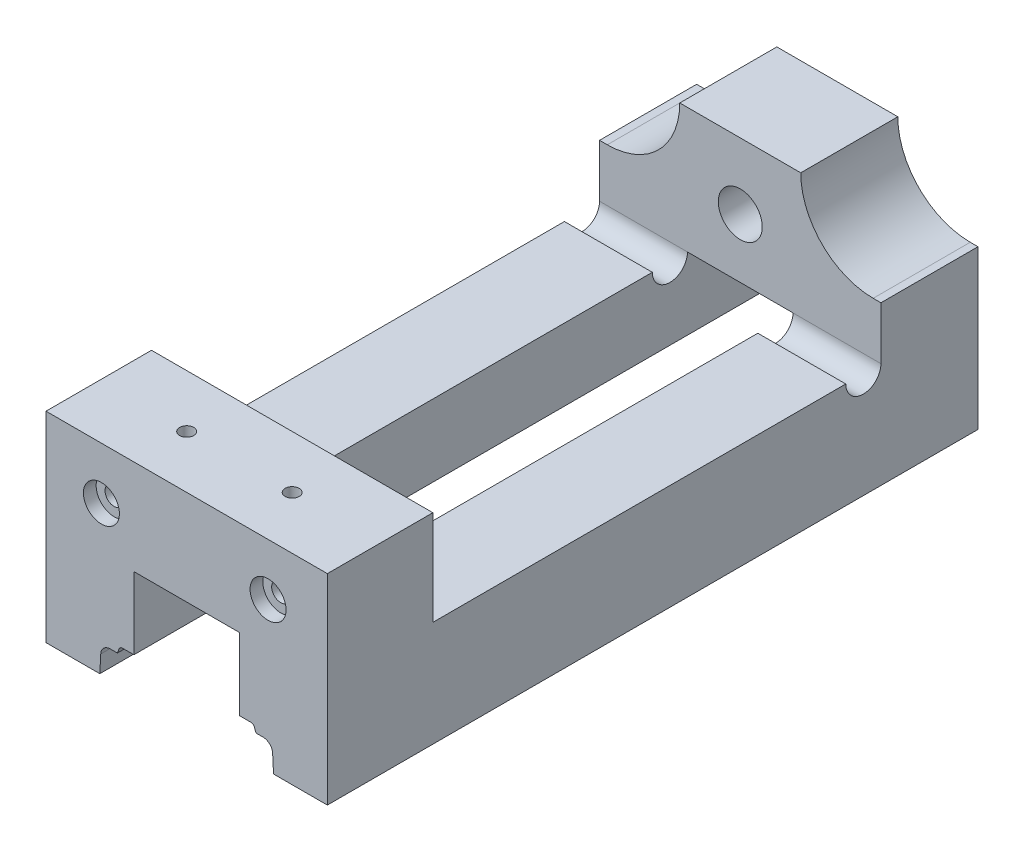
from build123d import *

# Parameters (mm, degrees)
SKETCH1_W                                    = 101.6
SKETCH1_H                                    = 83.312
SOLID_EXTRUDE_DEPTH                          = 234.95
BOTTOM_SLIDE_WAY_CUT_EXTRUDE_DEPTH           = 270.193149697
THROAT_CASTING_CUT_EXTRUDE_DEPTH             = 270.193149697
SHOULDERS_SCREW_HOLE_CUT_EXTRUDE_REACH       = 271.193
SKETCH4_R                                    = 7.9375
CBORE_START                                  = -38.1
CBORE_FOR_M6_PAN_HEAD_MACHINE_SCREW1_OUT_R   = 3.3
CBORE_FOR_M6_PAN_HEAD_MACHINE_SCREW1_DEPTH   = 38.1
CBORE_START_2                                = -4.6
CBORE_FOR_M6_PAN_HEAD_MACHINE_SCREW1_2_O_R   = 6.5
CBORE_FOR_M6_PAN_HEAD_MACHINE_SCREW1_2_O_R_2 = 3.3
CBORE_FOR_M6_PAN_HEAD_MACHINE_SCREW1_2_DEPTH = 4.6
SKETCH7_W                                    = 38.1
SKETCH7_H                                    = 10.922
STATIONARY_JAW_TRIM_CUT_EXTRUDE1_DEPTH       = 270.193149697
F_1_4_20_TAPPED_HOLE1_D                      = 5.1054
F_1_4_20_TAPPED_HOLE1_DEPTH                  = 14.986
F_1_4_20_TAPPED_HOLE1_TIP                    = 1.533816902
F_10_32_TAPPED_HOLE1_D                       = 4.0386
F_10_32_TAPPED_HOLE1_DEPTH                   = 11.938
F_10_32_TAPPED_HOLE1_TIP                     = 1.213317848


# Read off the part's stored shape, not the designer's step: CBORE for M6 Pan Head Machine Screw1
with BuildPart() as part:
    # Sketch1 → Solid extrude (new body)
    with BuildSketch(Plane.XY):
        with Locations((50.8, 41.656)):
            Rectangle(SKETCH1_W, SKETCH1_H)
    extrude(amount=-SOLID_EXTRUDE_DEPTH)

    # Sketch2 → Bottom slide way cut extrude (cut, through all)
    with BuildSketch(Plane.XY):
        with BuildLine():
            Line((19.431, 0), (19.763794004, 6.35008787))
            ThreePointArc((19.763794004, 6.35008787), (20.84487401, 8.695131686), (23.243283382, 9.652))
            Line((23.243283382, 9.652), (25.781, 9.652))
            Line((25.781, 9.652), (26.326795038, 11.151559542))
            ThreePointArc((26.326795038, 11.151559542), (26.849188972, 11.832356572), (27.667598166, 12.0904))
            Line((27.667598166, 12.0904), (31.75, 12.0904))
            Line((31.75, 12.0904), (31.75, 38.1))
            Line((31.75, 38.1), (69.85, 38.1))
            Line((69.85, 38.1), (69.85, 12.0904))
            Line((69.85, 12.0904), (73.932401834, 12.0904))
            ThreePointArc((73.932401834, 12.0904), (74.750811028, 11.832356572), (75.273204962, 11.151559542))
            Line((75.273204962, 11.151559542), (75.819, 9.652))
            Line((75.819, 9.652), (78.356716618, 9.652))
            ThreePointArc((78.356716618, 9.652), (80.75512599, 8.695131686), (81.836205996, 6.35008787))
            Line((81.836205996, 6.35008787), (82.169, 0))
            Line((82.169, 0), (19.431, 0))
        make_face()
    extrude(amount=-BOTTOM_SLIDE_WAY_CUT_EXTRUDE_DEPTH, mode=Mode.SUBTRACT)

    # Sketch3 → Throat/casting cut extrude (cut, through all)
    with BuildSketch(Plane(origin=(101.6, 0, 0), x_dir=(0, 0, -1), z_dir=(1, 0, 0))):
        with BuildLine():
            Line((0, 74.58075), (19.05, 74.58075))
            ThreePointArc((19.05, 74.58075), (23.540128061, 76.440621939), (25.4, 80.93075))
            Line((25.4, 80.93075), (25.4, 83.312))
            Line((25.4, 83.312), (0, 83.312))
            Line((0, 83.312), (0, 74.58075))
        make_face()
        with BuildLine():
            Line((38.1, 83.312), (38.1, 38.1))
            Line((38.1, 38.1), (187.198, 38.1))
            ThreePointArc((187.198, 38.1), (193.548, 31.75), (199.898, 38.1))
            Line((199.898, 38.1), (199.898, 83.312))
            Line((199.898, 83.312), (38.1, 83.312))
        make_face()
    extrude(amount=-THROAT_CASTING_CUT_EXTRUDE_DEPTH, mode=Mode.SUBTRACT)

    # Sketch4 → Shoulders/screw hole cut extrude (cut, up to next)
    with BuildSketch(Plane(origin=(0, 0, -234.95), x_dir=(-1, 0, 0), z_dir=(0, 0, -1)), mode=Mode.PRIVATE) as shoulders_screw_hole_cut_extrude_sk1:
        with Locations((-50.8, 59.436)):
            Circle(SKETCH4_R)
    shoulders_screw_hole_cut_extrude_tool1 = extrude(shoulders_screw_hole_cut_extrude_sk1.sketch, amount=-SHOULDERS_SCREW_HOLE_CUT_EXTRUDE_REACH, mode=Mode.PRIVATE) & part.part
    # Sketch4 → Shoulders/screw hole cut extrude (cut, up to next)
    with BuildSketch(Plane(origin=(0, 0, -234.95), x_dir=(-1, 0, 0), z_dir=(0, 0, -1)), mode=Mode.PRIVATE) as shoulders_screw_hole_cut_extrude_sk2:
        with BuildLine():
            Line((-2.794, 57.15), (0, 57.15))
            Line((0, 57.15), (0, 83.312))
            Line((0, 83.312), (-28.956, 83.312))
            ThreePointArc((-28.956, 83.312), (-21.293327609, 64.812672391), (-2.794, 57.15))
        make_face()
    shoulders_screw_hole_cut_extrude_tool2 = extrude(shoulders_screw_hole_cut_extrude_sk2.sketch, amount=-SHOULDERS_SCREW_HOLE_CUT_EXTRUDE_REACH, mode=Mode.PRIVATE) & part.part
    # Sketch4 → Shoulders/screw hole cut extrude (cut, up to next)
    with BuildSketch(Plane(origin=(0, 0, -234.95), x_dir=(-1, 0, 0), z_dir=(0, 0, -1)), mode=Mode.PRIVATE) as shoulders_screw_hole_cut_extrude_sk3:
        with BuildLine():
            Line((-101.6, 57.15), (-101.6, 83.312))
            Line((-101.6, 83.312), (-72.644, 83.312))
            ThreePointArc((-72.644, 83.312), (-80.306672391, 64.812672391), (-98.806, 57.15))
            Line((-98.806, 57.15), (-101.6, 57.15))
        make_face()
    shoulders_screw_hole_cut_extrude_tool3 = extrude(shoulders_screw_hole_cut_extrude_sk3.sketch, amount=-SHOULDERS_SCREW_HOLE_CUT_EXTRUDE_REACH, mode=Mode.PRIVATE) & part.part
    add(shoulders_screw_hole_cut_extrude_tool1.solids().sort_by_distance((50.8, 59.436, -234.95))[0], mode=Mode.SUBTRACT)
    add(shoulders_screw_hole_cut_extrude_tool2.solids().sort_by_distance((12.401182, 71.971794, -234.95))[0], mode=Mode.SUBTRACT)
    add(shoulders_screw_hole_cut_extrude_tool3.solids().sort_by_distance((89.198818, 71.971794, -234.95))[0], mode=Mode.SUBTRACT)

    # CBORE for M6 Pan Head Machine Screw1 out → CBORE for M6 Pan Head Machine Screw1 (cut)
    with BuildSketch(Plane.XY.offset(CBORE_START)):
        with Locations((80.187245779, 53.586240129)):
            Circle(CBORE_FOR_M6_PAN_HEAD_MACHINE_SCREW1_OUT_R)
        with Locations((20.004838326, 53.586240129)):
            Circle(CBORE_FOR_M6_PAN_HEAD_MACHINE_SCREW1_OUT_R)
    extrude(amount=CBORE_FOR_M6_PAN_HEAD_MACHINE_SCREW1_DEPTH, mode=Mode.SUBTRACT)

    # CBORE for M6 Pan Head Machine Screw1 2 o → CBORE for M6 Pan Head Machine Screw1 2 (cut)
    # profile 1 of 2: a face of its own
    with BuildSketch(Plane.XY.offset(CBORE_START_2)):
        with Locations((80.187245779, 53.586240129)):
            Circle(CBORE_FOR_M6_PAN_HEAD_MACHINE_SCREW1_2_O_R)
        with Locations((80.187245779, 53.586240129)):
            Circle(CBORE_FOR_M6_PAN_HEAD_MACHINE_SCREW1_2_O_R_2, mode=Mode.SUBTRACT)
    # profile 2 of 2: a face of its own
    with BuildSketch(Plane.XY.offset(CBORE_START_2)):
        with Locations((20.004838326, 53.586240129)):
            Circle(CBORE_FOR_M6_PAN_HEAD_MACHINE_SCREW1_2_O_R)
        with Locations((20.004838326, 53.586240129)):
            Circle(CBORE_FOR_M6_PAN_HEAD_MACHINE_SCREW1_2_O_R_2, mode=Mode.SUBTRACT)
    extrude(amount=CBORE_FOR_M6_PAN_HEAD_MACHINE_SCREW1_2_DEPTH, mode=Mode.SUBTRACT)

    # Sketch7 → Stationary jaw trim Cut-Extrude1 (cut, through all)
    with BuildSketch(Plane(origin=(101.6, 0, 0), x_dir=(0, 0, -1), z_dir=(1, 0, 0))):
        with Locations((19.05, 77.851)):
            Rectangle(SKETCH7_W, SKETCH7_H)
    extrude(amount=-STATIONARY_JAW_TRIM_CUT_EXTRUDE1_DEPTH, mode=Mode.SUBTRACT)

    # 1/4-20 Tapped Hole1
    with Locations(Plane(origin=(50.8, 72.39, 0), x_dir=(-1, 0, 0), z_dir=(0, 1, 0))):
        with Locations((19.05, -19.05), (-19.05, -19.05)):
            Hole(F_1_4_20_TAPPED_HOLE1_D / 2, depth=F_1_4_20_TAPPED_HOLE1_DEPTH)
            with Locations((0, 0, -(F_1_4_20_TAPPED_HOLE1_DEPTH + F_1_4_20_TAPPED_HOLE1_TIP / 2))):  # 118° drill point
                Cone(0, F_1_4_20_TAPPED_HOLE1_D / 2, F_1_4_20_TAPPED_HOLE1_TIP, mode=Mode.SUBTRACT)

    # #10-32 Tapped Hole1
    with Locations(Plane(origin=(0, 0, 0), x_dir=(-1, 0, 0), z_dir=(0, -1, 0))):
        with Locations((-9.7155, 88.9), (-9.7155, 44.45), (-9.7155, 133.35), (-91.8845, 44.45), (-91.8845, 88.9), (-91.8845, 133.35)):
            Hole(F_10_32_TAPPED_HOLE1_D / 2, depth=F_10_32_TAPPED_HOLE1_DEPTH)
            with Locations((0, 0, -(F_10_32_TAPPED_HOLE1_DEPTH + F_10_32_TAPPED_HOLE1_TIP / 2))):  # 118° drill point
                Cone(0, F_10_32_TAPPED_HOLE1_D / 2, F_10_32_TAPPED_HOLE1_TIP, mode=Mode.SUBTRACT)


solid = part.part
